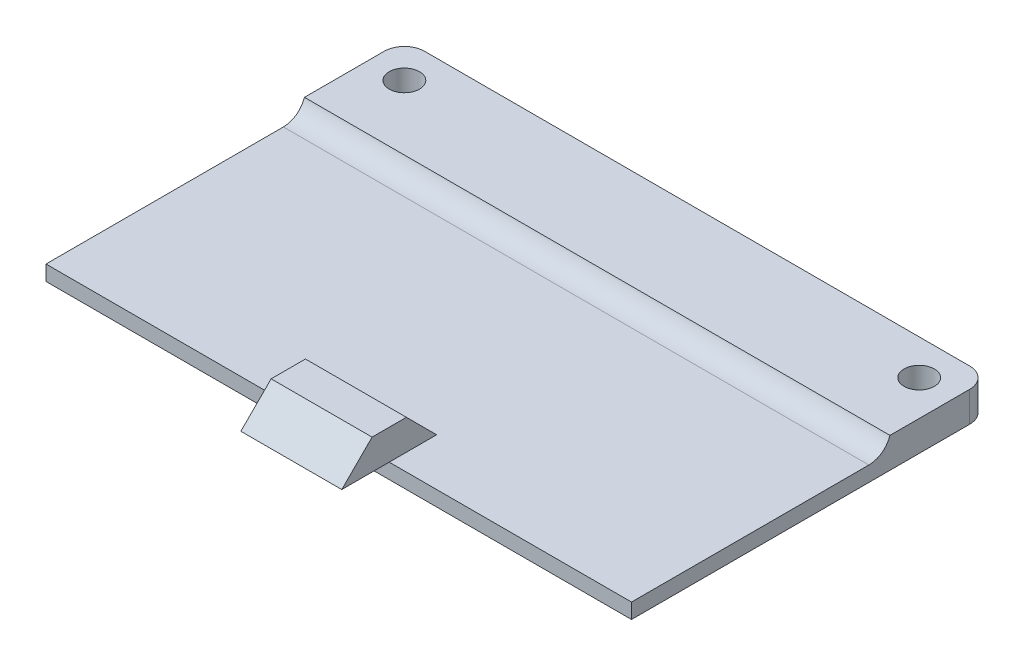
from build123d import *

# Parameters (mm, degrees)
SKETCH1_W           = 58
SKETCH1_H           = 35.5
SKETCH1_R           = 1.5
BOSS_EXTRUDE1_DEPTH = 1.5
SKETCH2_W           = 58
SKETCH2_H           = 9.9
SKETCH2_R           = 1.5
BOSS_EXTRUDE3_DEPTH = 1.5
FILLET1_R           = 2.2
SKETCH2_3_W         = 10
SKETCH2_3_H         = 4.7
BOSS_EXTRUDE4_DEPTH = 3
CHAMFER1_SIZE       = 3
FILLET2_R           = 2


# Some blends are built 0.0001 mm under size
with BuildPart() as part:
    # Sketch1 → Boss-Extrude1 (new body)
    with BuildSketch(Plane(origin=(0, 0, 0), x_dir=(1, 0, 0), z_dir=(0, 1, 0))):
        Rectangle(SKETCH1_W, SKETCH1_H)
        with Locations(Location((-25.5, 14.25, 0), (0, 0, 270))):
            Circle(SKETCH1_R, mode=Mode.SUBTRACT)
        with Locations(Location((25.5, 14.25, 0), (0, 0, 90))):
            Circle(SKETCH1_R, mode=Mode.SUBTRACT)
    extrude(amount=BOSS_EXTRUDE1_DEPTH)

    # Sketch2 → Boss-Extrude3 (add)
    with BuildSketch(Plane(origin=(0, 1.5, 0), x_dir=(1, 0, 0), z_dir=(0, 1, 0))):
        with Locations((0, 12.8)):
            Rectangle(SKETCH2_W, SKETCH2_H)
        with Locations(Location((-25.5, 14.25, 0), (0, 0, 270))):
            Circle(SKETCH2_R, mode=Mode.SUBTRACT)
        with Locations(Location((25.5, 14.25, 0), (0, 0, 90))):
            Circle(SKETCH2_R, mode=Mode.SUBTRACT)
    extrude(amount=BOSS_EXTRUDE3_DEPTH)

    # Fillet1
    # the kernel refuses this fillet: 2.2 mm, written as the material it adds along each edge
    with BuildSketch(Plane(origin=(-29, 1.5, -7.85), x_dir=(0, 0, 1), z_dir=(1, 0, 0))) as fillet1_piece_1:
        with BuildLine():
            CenterArc((2.085665361, -2.2), FILLET1_R, 90, 71.446995465)
            Line((0, -1.5), (-0.041713307, -1.486))
            ThreePointArc((-0.041713307, -1.486), (-0.044, -0.75), (-0.044, 0))
            Line((-0.044, 0), (0, 0.044))
            Line((0, 0.044), (2.085665361, 0.044))
            Line((2.085665361, 0.044), (2.085665361, 0))
        make_face()
    extrude(amount=58)

    # Sketch2<3> → Boss-Extrude4 (add)
    with BuildSketch(Plane(origin=(0, 1.5, 0), x_dir=(1, 0, 0), z_dir=(0, 1, 0))):
        with Locations((0, -20.1)):
            Rectangle(SKETCH2_3_W, SKETCH2_3_H)
        with Locations((0, -15.4)):
            Rectangle(SKETCH2_3_W, SKETCH2_3_H)
    extrude(amount=BOSS_EXTRUDE4_DEPTH)

    # Chamfer1
    chamfer1_edges = [part.edges().sort_by_distance(p)[0] for p in [
        (0, 4.5, 13.05),
        (0, 4.5, 22.45),
    ]]
    chamfer(chamfer1_edges, length=CHAMFER1_SIZE - 0.0001)  # a hair under: the kernel refuses the full size

    # Fillet2
    fillet2_edges = [part.edges().sort_by_distance(p)[0] for p in [
        (-29, 1.5, -17.75),
        (29, 1.5, -17.75),
    ]]
    fillet(fillet2_edges, radius=FILLET2_R)


solid = part.part
